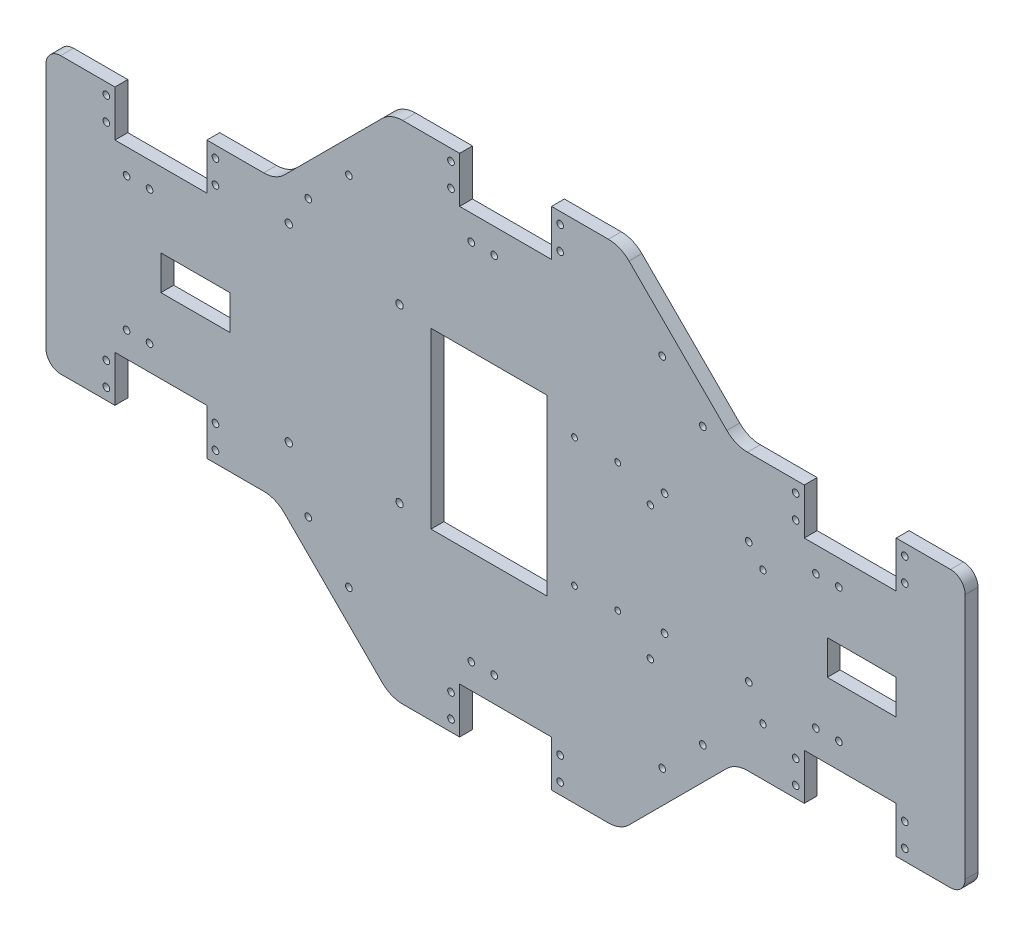
from build123d import *

# Parameters (mm, degrees)
BOSS_EXTRU_1_DEPTH       = 5.6
ENL_V_MAT_EXTRU_1_REACH  = 416.887
ESQUISSE2_W              = 40
ESQUISSE2_H              = 20
ENL_V_MAT_EXTRU_2_REACH  = 416.887
ESQUISSE3_R              = 1.45
SKETCH2_W                = 40
SKETCH2_H                = 20
CUT_EXTRUDE2_DEPTH       = 415.887165384
SKETCH5_R                = 1.45
CUT_EXTRUDE4_DEPTH       = 415.887165384
ESQUISSE4_R              = 1.375
ENL_V_MAT_EXTRU_4_DEPTH  = 415.887165384
ESQUISSE6_R              = 1.45
ENL_V_MAT_EXTRU_6_DEPTH  = 415.887165384
ESQUISSE8_R              = 1.25
ENL_V_MAT_EXTRU_7_DEPTH  = 415.887165384
ESQUISSE9_R              = 1.6
ENL_V_MAT_EXTRU_8_DEPTH  = 415.887165384
ESQUISSE10_W             = 50.45
ESQUISSE10_H             = 75.69
ENL_V_MAT_EXTRU_9_DEPTH  = 415.887165384
ESQUISSE11_W             = 30
ESQUISSE11_H             = 15
ENL_V_MAT_EXTRU_10_DEPTH = 415.887165384
ESQUISSE12_R             = 1.45
ENL_V_MAT_EXTRU_11_DEPTH = 415.887165384
FILLET1_R                = 6.35
FILLET2_R                = 12.7


with BuildPart() as part:
    # Esquisse1 → Boss.-Extru.1 (new body)
    with BuildSketch(Plane.XY):
        Polygon((100, -60), (150, -110), (250, -110), (300, -60), (400, -60), (400, 0), (25.838605695, 0), (0, 0), (0, -60), align=None)
    boss_extru_1 = extrude(amount=BOSS_EXTRU_1_DEPTH)

    # Esquisse2 → Enlèv. mat.-Extru.1 (cut, up to next)
    with BuildSketch(Plane.XY.offset(5.6), mode=Mode.PRIVATE) as enl_v_mat_extru_1_sk1:
        with Locations((50, -50)):
            Rectangle(ESQUISSE2_W, ESQUISSE2_H)
    enl_v_mat_extru_1_tool1 = extrude(enl_v_mat_extru_1_sk1.sketch, amount=-ENL_V_MAT_EXTRU_1_REACH, mode=Mode.PRIVATE) & part.part
    enl_v_mat_extru_1 = enl_v_mat_extru_1_tool1.solids().sort_by_distance((50, -50, 5.6))[0]
    add(enl_v_mat_extru_1, mode=Mode.SUBTRACT)

    # Esquisse3 → Enlèv. mat.-Extru.2 (cut, up to next)
    with BuildSketch(Plane.XY.offset(5.6), mode=Mode.PRIVATE) as enl_v_mat_extru_2_sk1:
        with Locations((26.25, -55.08)):
            Circle(ESQUISSE3_R)
    enl_v_mat_extru_2_tool1 = extrude(enl_v_mat_extru_2_sk1.sketch, amount=-ENL_V_MAT_EXTRU_2_REACH, mode=Mode.PRIVATE) & part.part
    # Esquisse3 → Enlèv. mat.-Extru.2 (cut, up to next)
    with BuildSketch(Plane.XY.offset(5.6), mode=Mode.PRIVATE) as enl_v_mat_extru_2_sk2:
        with Locations((73.75, -55.08)):
            Circle(ESQUISSE3_R)
    enl_v_mat_extru_2_tool2 = extrude(enl_v_mat_extru_2_sk2.sketch, amount=-ENL_V_MAT_EXTRU_2_REACH, mode=Mode.PRIVATE) & part.part
    # Esquisse3 → Enlèv. mat.-Extru.2 (cut, up to next)
    with BuildSketch(Plane.XY.offset(5.6), mode=Mode.PRIVATE) as enl_v_mat_extru_2_sk3:
        with Locations((73.75, -44.92)):
            Circle(ESQUISSE3_R)
    enl_v_mat_extru_2_tool3 = extrude(enl_v_mat_extru_2_sk3.sketch, amount=-ENL_V_MAT_EXTRU_2_REACH, mode=Mode.PRIVATE) & part.part
    # Esquisse3 → Enlèv. mat.-Extru.2 (cut, up to next)
    with BuildSketch(Plane.XY.offset(5.6), mode=Mode.PRIVATE) as enl_v_mat_extru_2_sk4:
        with Locations((26.25, -44.92)):
            Circle(ESQUISSE3_R)
    enl_v_mat_extru_2_tool4 = extrude(enl_v_mat_extru_2_sk4.sketch, amount=-ENL_V_MAT_EXTRU_2_REACH, mode=Mode.PRIVATE) & part.part
    # Esquisse3 → Enlèv. mat.-Extru.2 (cut, up to next)
    with BuildSketch(Plane.XY.offset(5.6), mode=Mode.PRIVATE) as enl_v_mat_extru_2_sk5:
        with Locations((35.06, -29.09)):
            Circle(ESQUISSE3_R)
    enl_v_mat_extru_2_tool5 = extrude(enl_v_mat_extru_2_sk5.sketch, amount=-ENL_V_MAT_EXTRU_2_REACH, mode=Mode.PRIVATE) & part.part
    # Esquisse3 → Enlèv. mat.-Extru.2 (cut, up to next)
    with BuildSketch(Plane.XY.offset(5.6), mode=Mode.PRIVATE) as enl_v_mat_extru_2_sk6:
        with Locations((45.06, -29.09)):
            Circle(ESQUISSE3_R)
    enl_v_mat_extru_2_tool6 = extrude(enl_v_mat_extru_2_sk6.sketch, amount=-ENL_V_MAT_EXTRU_2_REACH, mode=Mode.PRIVATE) & part.part
    enl_v_mat_extru_2_1 = enl_v_mat_extru_2_tool1.solids().sort_by_distance((26.25, -55.08, 5.6))[0]
    add(enl_v_mat_extru_2_1, mode=Mode.SUBTRACT)
    enl_v_mat_extru_2_2 = enl_v_mat_extru_2_tool2.solids().sort_by_distance((73.75, -55.08, 5.6))[0]
    add(enl_v_mat_extru_2_2, mode=Mode.SUBTRACT)
    enl_v_mat_extru_2_3 = enl_v_mat_extru_2_tool3.solids().sort_by_distance((73.75, -44.92, 5.6))[0]
    add(enl_v_mat_extru_2_3, mode=Mode.SUBTRACT)
    enl_v_mat_extru_2_4 = enl_v_mat_extru_2_tool4.solids().sort_by_distance((26.25, -44.92, 5.6))[0]
    add(enl_v_mat_extru_2_4, mode=Mode.SUBTRACT)
    enl_v_mat_extru_2_5 = enl_v_mat_extru_2_tool5.solids().sort_by_distance((35.06, -29.09, 5.6))[0]
    add(enl_v_mat_extru_2_5, mode=Mode.SUBTRACT)
    enl_v_mat_extru_2_6 = enl_v_mat_extru_2_tool6.solids().sort_by_distance((45.06, -29.09, 5.6))[0]
    add(enl_v_mat_extru_2_6, mode=Mode.SUBTRACT)
    enl_v_mat_extru_2 = enl_v_mat_extru_2_1 + enl_v_mat_extru_2_2 + enl_v_mat_extru_2_3 + enl_v_mat_extru_2_4 + enl_v_mat_extru_2_5 + enl_v_mat_extru_2_6  # Enlèv. mat.-Extru.2 as one shape, for the pattern or mirror that repeats it

    # Sketch2 → Cut-Extrude2 (cut, symmetric)
    with BuildSketch(Plane.XY):
        with Locations((350, -50)):
            Rectangle(SKETCH2_W, SKETCH2_H)
        with Locations((200, -100)):
            Rectangle(SKETCH2_W, SKETCH2_H)
    cut_extrude2 = extrude(amount=CUT_EXTRUDE2_DEPTH, both=True, mode=Mode.SUBTRACT)

    # Sketch5 → Cut-Extrude4 (cut, through all)
    with BuildSketch(Plane.XY):
        with Locations((176.25, -105.08)):
            Circle(SKETCH5_R)
        with Locations((223.75, -105.08)):
            Circle(SKETCH5_R)
        with Locations((223.75, -94.92)):
            Circle(SKETCH5_R)
        with Locations((176.25, -94.92)):
            Circle(SKETCH5_R)
        with Locations((326.25, -55.08)):
            Circle(SKETCH5_R)
        with Locations((373.75, -55.08)):
            Circle(SKETCH5_R)
        with Locations((373.75, -44.92)):
            Circle(SKETCH5_R)
        with Locations((326.25, -44.92)):
            Circle(SKETCH5_R)
        with Locations((185.06, -79.09)):
            Circle(SKETCH5_R)
        with Locations((195.06, -79.09)):
            Circle(SKETCH5_R)
        with Locations((335.06, -29.09)):
            Circle(SKETCH5_R)
        with Locations((345.06, -29.09)):
            Circle(SKETCH5_R)
    cut_extrude4 = extrude(amount=CUT_EXTRUDE4_DEPTH, mode=Mode.SUBTRACT)

    # Mirror1: Boss.-Extru.1, Enlèv. mat.-Extru.1, Enlèv. mat.-Extru.2, Cut-Extrude2, Cut-Extrude4 across plane
    add(boss_extru_1.mirror(Plane.ZX))
    add(enl_v_mat_extru_1.mirror(Plane.ZX), mode=Mode.SUBTRACT)
    add(enl_v_mat_extru_2.mirror(Plane.ZX), mode=Mode.SUBTRACT)
    add(cut_extrude2.mirror(Plane.ZX), mode=Mode.SUBTRACT)
    add(cut_extrude4.mirror(Plane.ZX), mode=Mode.SUBTRACT)

    # Esquisse4 → Enlèv. mat.-Extru.4 (cut, through all)
    with BuildSketch(Plane.XY.offset(5.6)):
        with Locations((263, -39)):
            Circle(ESQUISSE4_R)
        with Locations((312, -39)):
            Circle(ESQUISSE4_R)
        with Locations((312, 19)):
            Circle(ESQUISSE4_R)
        with Locations((263, 19)):
            Circle(ESQUISSE4_R)
    extrude(amount=-ENL_V_MAT_EXTRU_4_DEPTH, mode=Mode.SUBTRACT)

    # Esquisse6 → Enlèv. mat.-Extru.6 (cut, through all)
    with BuildSketch(Plane(origin=(0, 0, 0), x_dir=(-1, 0, 0), z_dir=(0, 0, -1))):
        with Locations((-269.19, -26.31)):
            Circle(ESQUISSE6_R)
        with Locations((-305.82, -26.31)):
            Circle(ESQUISSE6_R)
        with Locations((-305.82, 26.52)):
            Circle(ESQUISSE6_R)
        with Locations((-269.19, 26.52)):
            Circle(ESQUISSE6_R)
    extrude(amount=-ENL_V_MAT_EXTRU_6_DEPTH, mode=Mode.SUBTRACT)

    # Esquisse8 → Enlèv. mat.-Extru.7 (cut, through all)
    with BuildSketch(Plane(origin=(0, 0, 0), x_dir=(-1, 0, 0), z_dir=(0, 0, -1))):
        with Locations((-230, 27.95)):
            Circle(ESQUISSE8_R)
        with Locations((-248.8, 27.95)):
            Circle(ESQUISSE8_R)
        with Locations((-248.8, -27.95)):
            Circle(ESQUISSE8_R)
        with Locations((-230, -27.95)):
            Circle(ESQUISSE8_R)
    extrude(amount=-ENL_V_MAT_EXTRU_7_DEPTH, mode=Mode.SUBTRACT)

    # Esquisse9 → Enlèv. mat.-Extru.8 (cut, through all)
    with BuildSketch(Plane(origin=(0, 0, 0), x_dir=(-1, 0, 0), z_dir=(0, 0, -1))):
        with Locations((-153.85903462, -34.88)):
            Circle(ESQUISSE9_R)
        with Locations((-105.63903462, -36.11)):
            Circle(ESQUISSE9_R)
        with Locations((-105.63903462, 46.36)):
            Circle(ESQUISSE9_R)
        with Locations((-153.85903462, 40)):
            Circle(ESQUISSE9_R)
    extrude(amount=-ENL_V_MAT_EXTRU_8_DEPTH, mode=Mode.SUBTRACT)

    # Esquisse10 → Enlèv. mat.-Extru.9 (cut, through all)
    with BuildSketch(Plane(origin=(0, 0, 0), x_dir=(-1, 0, 0), z_dir=(0, 0, -1))):
        with Locations((-192.775, -0.005)):
            Rectangle(ESQUISSE10_W, ESQUISSE10_H)
    extrude(amount=-ENL_V_MAT_EXTRU_9_DEPTH, mode=Mode.SUBTRACT)

    # Esquisse11 → Enlèv. mat.-Extru.10 (cut, through all)
    with BuildSketch(Plane(origin=(0, 0, 0), x_dir=(-1, 0, 0), z_dir=(0, 0, -1))):
        with Locations((-355, 0)):
            Rectangle(ESQUISSE11_W, ESQUISSE11_H)
        with Locations((-65, 0)):
            Rectangle(ESQUISSE11_W, ESQUISSE11_H)
    extrude(amount=-ENL_V_MAT_EXTRU_10_DEPTH, mode=Mode.SUBTRACT)

    # Esquisse12 → Enlèv. mat.-Extru.11 (cut, through all)
    with BuildSketch(Plane.XY.offset(5.6)):
        with Locations((131.819805153, 77.67766953)):
            Circle(ESQUISSE12_R)
        with Locations((114.142135624, 60)):
            Circle(ESQUISSE12_R)
        with Locations((285.857864376, 60)):
            Circle(ESQUISSE12_R)
        with Locations((268.180194847, 77.67766953)):
            Circle(ESQUISSE12_R)
        with Locations((285.857864376, -60)):
            Circle(ESQUISSE12_R)
        with Locations((268.180194847, -77.67766953)):
            Circle(ESQUISSE12_R)
        with Locations((131.819805153, -77.67766953)):
            Circle(ESQUISSE12_R)
        with Locations((114.142135624, -60)):
            Circle(ESQUISSE12_R)
    extrude(amount=-ENL_V_MAT_EXTRU_11_DEPTH, mode=Mode.SUBTRACT)

    # Fillet1
    fillet1_edges = [part.edges().sort_by_distance(p)[0] for p in [
        (400, 60, 2.8),
        (400, -60, 2.8),
        (0, -60, 2.8),
        (0, 60, 2.8),
    ]]
    fillet(fillet1_edges, radius=FILLET1_R)

    # Fillet2
    fillet2_edges = [part.edges().sort_by_distance(p)[0] for p in [
        (150, -110, 2.8),
        (100, -60, 2.8),
        (250, -110, 2.8),
        (300, -60, 2.8),
        (300, 60, 2.8),
        (250, 110, 2.8),
        (150, 110, 2.8),
        (100, 60, 2.8),
    ]]
    fillet(fillet2_edges, radius=FILLET2_R)


solid = part.part
